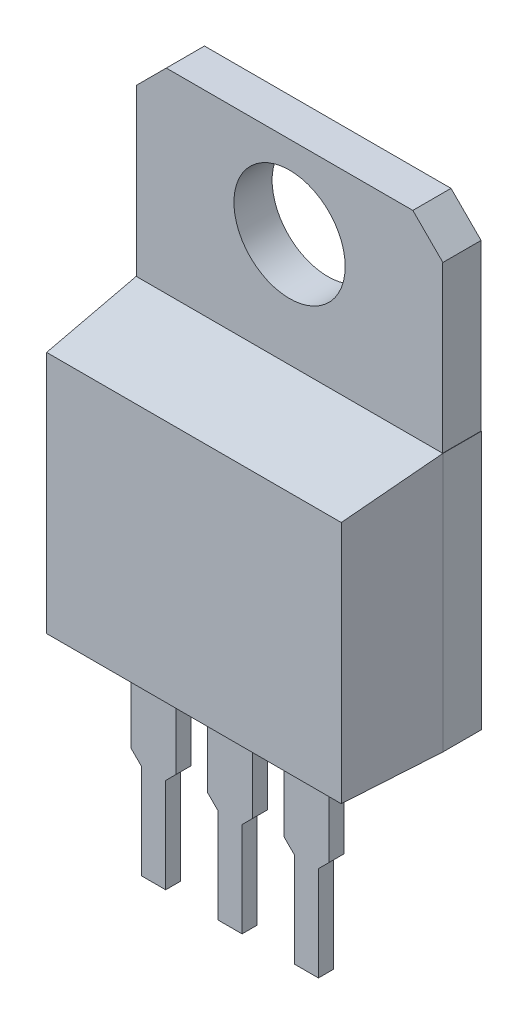
from build123d import *

# Parameters (mm, degrees)
ESQUISSE1_W             = 10.2
ESQUISSE1_H             = 15.1
ESQUISSE1_R             = 1.85
BOSS_EXTRU_1_DEPTH      = 1.27
ESQUISSE2_W             = 10.2
ESQUISSE2_H             = 8.6
BOSS_EXTRU_2_DEPTH      = 3.18
ENL_V_MAT_EXTRU_1_DEPTH = 11.944062317
ENL_V_MAT_EXTRU_2_DEPTH = 19.757731739
ESQUISSE5_W             = 1.5
ESQUISSE5_H             = 0.5
BOSS_EXTRU_3_DEPTH      = 3.1
ESQUISSE6_W             = 0.8
ESQUISSE6_H             = 0.5
BOSS_EXTRU_4_DEPTH      = 3.5
CHANFREIN1_SIZE         = 0.35
CHANFREIN2_SIZE         = 1
ESQUISSE8_W             = 1.27
ESQUISSE8_H             = 5.5
ENL_V_MAT_EXTRU_4_DEPTH = 0.01
ESQUISSE9_W             = 1.27
ESQUISSE9_H             = 5.5
ENL_V_MAT_EXTRU_5_DEPTH = 0.01
BOSS_EXTRU_6_DEPTH      = 0.01


with BuildPart() as part:
    # Esquisse1 → Boss.-Extru.1 (new body)
    with BuildSketch(Plane.XY):
        with Locations((0, 7.55)):
            Rectangle(ESQUISSE1_W, ESQUISSE1_H)
        with Locations((0, 12.36)):
            Circle(ESQUISSE1_R, mode=Mode.SUBTRACT)
    extrude(amount=BOSS_EXTRU_1_DEPTH)

    # Esquisse2 → Boss.-Extru.2 (add)
    with BuildSketch(Plane.XY.offset(1.27)):
        with Locations((0, 4.3)):
            Rectangle(ESQUISSE2_W, ESQUISSE2_H)
    extrude(amount=BOSS_EXTRU_2_DEPTH)

    # Esquisse3 → Enlèv. mat.-Extru.1 (cut, through all)
    with BuildSketch(Plane(origin=(0, 8.6, 0), x_dir=(1, 0, 0), z_dir=(0, 1, 0))):
        Polygon((5.1, -1.27), (4.9, -4.45), (5.1, -4.45), align=None)
        Polygon((-5.1, -1.27), (-5.1, -4.45), (-4.9, -4.45), align=None)
    extrude(amount=-ENL_V_MAT_EXTRU_1_DEPTH, mode=Mode.SUBTRACT)

    # Esquisse4 → Enlèv. mat.-Extru.2 (cut, through all)
    with BuildSketch(Plane(origin=(5.1, 0, 0), x_dir=(0, 0, -1), z_dir=(1, 0, 0))):
        Polygon((-1.27, 8.6), (-4.45, 8.1), (-4.45, 8.6), align=None)
    extrude(amount=-ENL_V_MAT_EXTRU_2_DEPTH, mode=Mode.SUBTRACT)

    # Esquisse5 → Boss.-Extru.3 (add)
    with BuildSketch(Plane.XZ):
        with Locations((0, 3)):
            Rectangle(ESQUISSE5_W, ESQUISSE5_H)
        with Locations((2.54, 3)):
            Rectangle(ESQUISSE5_W, ESQUISSE5_H)
        with Locations((-2.54, 3)):
            Rectangle(ESQUISSE5_W, ESQUISSE5_H)
    extrude(amount=BOSS_EXTRU_3_DEPTH)

    # Esquisse6 → Boss.-Extru.4 (add)
    with BuildSketch(Plane.XZ.offset(3.1)):
        with Locations((-2.54, 3)):
            Rectangle(ESQUISSE6_W, ESQUISSE6_H)
        with Locations((0, 3)):
            Rectangle(ESQUISSE6_W, ESQUISSE6_H)
        with Locations((2.54, 3)):
            Rectangle(ESQUISSE6_W, ESQUISSE6_H)
    extrude(amount=BOSS_EXTRU_4_DEPTH)

    # Chanfrein1
    chanfrein1_edges = [part.edges().sort_by_distance(p)[0] for p in [
        (2.94, -3.1, 3),
        (0.4, -3.1, 3),
        (-2.14, -3.1, 3),
        (2.14, -3.1, 3),
        (-0.4, -3.1, 3),
        (-2.94, -3.1, 3),
    ]]
    chamfer(chanfrein1_edges, length=CHANFREIN1_SIZE - 0.0001)  # a hair under: the kernel refuses the full size

    # Chanfrein2
    chanfrein2_edges = [part.edges().sort_by_distance(p)[0] for p in [
        (-5.1, 15.1, 0.635),
        (5.1, 15.1, 0.635),
    ]]
    chamfer(chanfrein2_edges, length=CHANFREIN2_SIZE)

    # Esquisse8 → Enlèv. mat.-Extru.4 (cut)
    with BuildSketch(Plane(origin=(5.1, 0, 0), x_dir=(0, 0, -1), z_dir=(1, 0, 0))):
        with Locations((-0.635, 11.35)):
            Rectangle(ESQUISSE8_W, ESQUISSE8_H)
    extrude(amount=-ENL_V_MAT_EXTRU_4_DEPTH, mode=Mode.SUBTRACT)

    # Esquisse9 → Enlèv. mat.-Extru.5 (cut)
    with BuildSketch(Plane.ZY.offset(5.1)):
        with Locations((0.635, 11.35)):
            Rectangle(ESQUISSE9_W, ESQUISSE9_H)
    extrude(amount=-ENL_V_MAT_EXTRU_5_DEPTH, mode=Mode.SUBTRACT)

    # Esquisse11 → Boss.-Extru.6 (add)
    with BuildSketch(Plane(origin=(0, 0, 0), x_dir=(-1, 0, 0), z_dir=(0, 0, -1))):
        Polygon((-5.1, 0), (-5.1, 8.6), (-3.6, 8.6), (-3.6, 2), (3.59, 2), (3.59, 8.6), (5.09, 8.6), (5.1, 0), align=None)
    extrude(amount=BOSS_EXTRU_6_DEPTH)


solid = part.part
